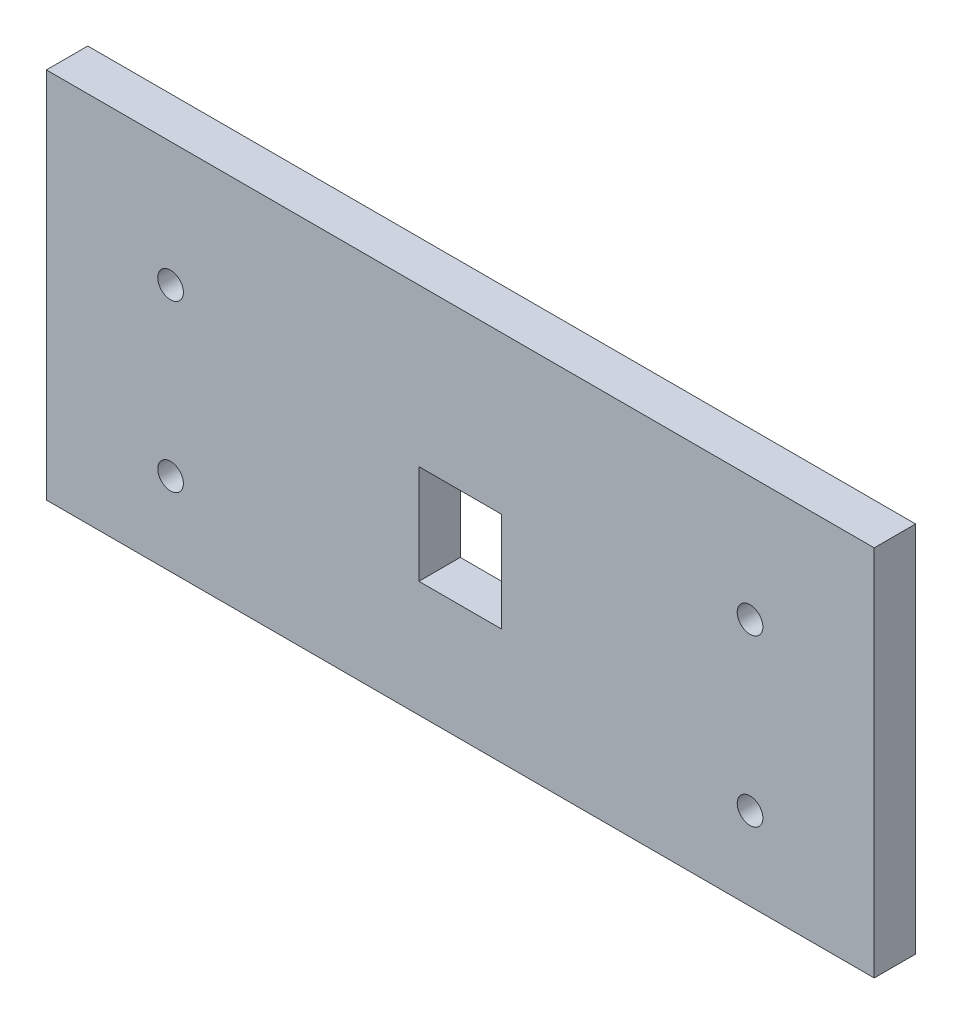
from build123d import *

# Parameters (mm, degrees)
ESQUISSE1_W        = 100
ESQUISSE1_H        = 45
ESQUISSE1_R        = 1.55
ESQUISSE1_W_2      = 10
ESQUISSE1_H_2      = 12
BOSS_EXTRU_1_DEPTH = 5


with BuildPart() as part:
    # Esquisse1 → Boss.-Extru.1 (new body)
    with BuildSketch(Plane.XY):
        Rectangle(ESQUISSE1_W, ESQUISSE1_H)
        with Locations((-35, -12.5)):
            Circle(ESQUISSE1_R, mode=Mode.SUBTRACT)
        with Locations((35, -12.5)):
            Circle(ESQUISSE1_R, mode=Mode.SUBTRACT)
        with Locations((35, 7.5)):
            Circle(ESQUISSE1_R, mode=Mode.SUBTRACT)
        with Locations((-35, 7.5)):
            Circle(ESQUISSE1_R, mode=Mode.SUBTRACT)
        with Locations((0, -2.5)):
            Rectangle(ESQUISSE1_W_2, ESQUISSE1_H_2, mode=Mode.SUBTRACT)
    extrude(amount=-BOSS_EXTRU_1_DEPTH)


solid = part.part
